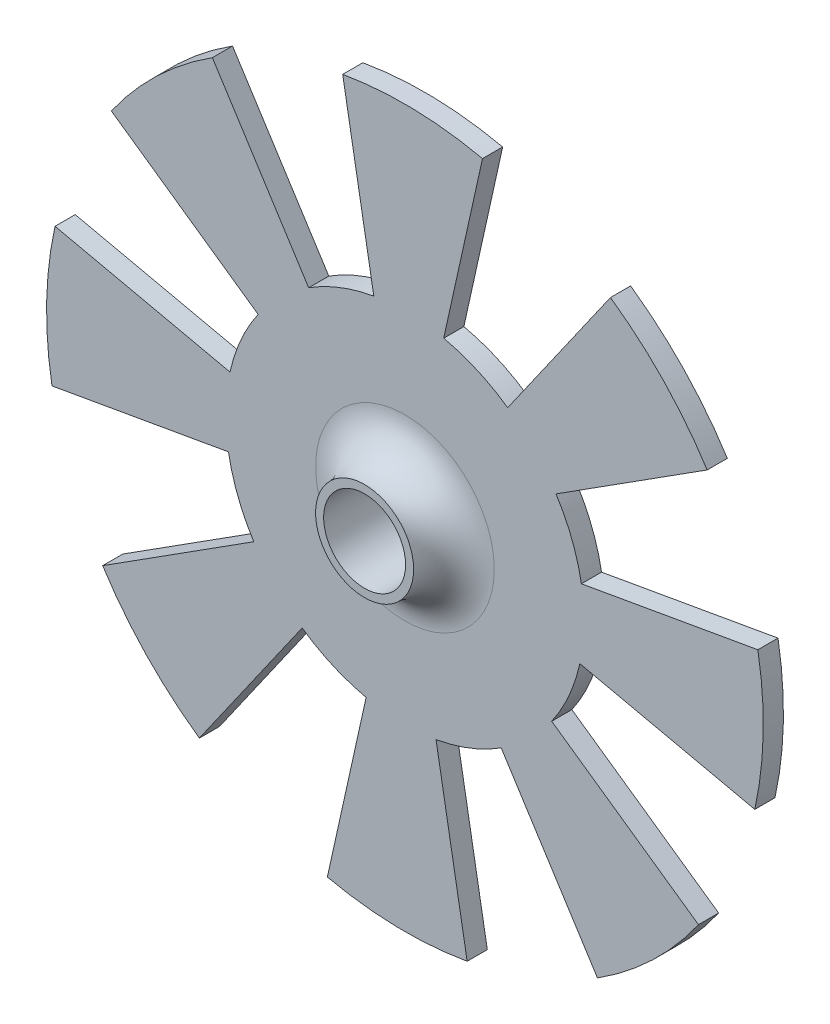
from build123d import *

# Parameters (mm, degrees)
SKETCH1_R           = 8.89
SKETCH1_R_2         = 1.016
BOSS_EXTRUDE1_DEPTH = 0.5
CUT_EXTRUDE1_DEPTH  = 0.5
BOSS_EXTRUDE2_START = 1
SKETCH3_R           = 1.216
SKETCH3_R_2         = 1.016
BOSS_EXTRUDE2_DEPTH = 1
FILLET1_R           = 1


with BuildPart() as part:
    # Sketch1 → Boss-Extrude1 (new body)
    with BuildSketch(Plane.XY):
        Circle(SKETCH1_R)
        Circle(SKETCH1_R_2, mode=Mode.SUBTRACT)
    extrude(amount=-BOSS_EXTRUDE1_DEPTH)

    # Sketch2 → Cut-Extrude1 (cut)
    with BuildSketch(Plane.XY):
        with BuildLine():
            ThreePointArc((-2.388296759, 3.748874977), (-1.61103708, 4.142774979), (-0.77186615, 4.377470462))
            Line((-0.77186615, 4.377470462), (-1.543732299, 8.754940924))
            ThreePointArc((-1.543732299, 8.754940924), (-3.22207416, 8.285549958), (-4.776593518, 7.497749953))
            Line((-4.776593518, 7.497749953), (-2.388296759, 3.748874977))
        make_face()
        with BuildLine():
            ThreePointArc((5.099094519, 7.282261674), (3.580418073, 8.137119049), (1.924148168, 8.679271503))
            Line((1.924148168, 8.679271503), (0.962074084, 4.339635752))
            ThreePointArc((0.962074084, 4.339635752), (1.790209036, 4.068559525), (2.54954726, 3.641130837))
            Line((2.54954726, 3.641130837), (5.099094519, 7.282261674))
        make_face()
        with BuildLine():
            ThreePointArc((8.754940924, 1.543732299), (8.285549958, 3.22207416), (7.497749953, 4.776593518))
            Line((7.497749953, 4.776593518), (3.748874977, 2.388296759))
            ThreePointArc((3.748874977, 2.388296759), (4.142774979, 1.61103708), (4.377470462, 0.77186615))
            Line((4.377470462, 0.77186615), (8.754940924, 1.543732299))
        make_face()
        with BuildLine():
            ThreePointArc((7.282261674, -5.099094519), (8.137119049, -3.580418073), (8.679271503, -1.924148168))
            Line((8.679271503, -1.924148168), (4.339635752, -0.962074084))
            ThreePointArc((4.339635752, -0.962074084), (4.068559525, -1.790209036), (3.641130837, -2.54954726))
            Line((3.641130837, -2.54954726), (7.282261674, -5.099094519))
        make_face()
        with BuildLine():
            ThreePointArc((1.543732299, -8.754940924), (3.22207416, -8.285549958), (4.776593518, -7.497749953))
            Line((4.776593518, -7.497749953), (2.388296759, -3.748874977))
            ThreePointArc((2.388296759, -3.748874977), (1.61103708, -4.142774979), (0.77186615, -4.377470462))
            Line((0.77186615, -4.377470462), (1.543732299, -8.754940924))
        make_face()
        with BuildLine():
            Line((-2.54954726, -3.641130837), (-5.099094519, -7.282261674))
            ThreePointArc((-5.099094519, -7.282261674), (-3.580418073, -8.137119049), (-1.924148168, -8.679271503))
            Line((-1.924148168, -8.679271503), (-0.962074084, -4.339635752))
            ThreePointArc((-0.962074084, -4.339635752), (-1.790209036, -4.068559525), (-2.54954726, -3.641130837))
        make_face()
        with BuildLine():
            Line((-4.377470462, -0.77186615), (-8.754940924, -1.543732299))
            ThreePointArc((-8.754940924, -1.543732299), (-8.285549958, -3.22207416), (-7.497749953, -4.776593518))
            Line((-7.497749953, -4.776593518), (-3.748874977, -2.388296759))
            ThreePointArc((-3.748874977, -2.388296759), (-4.142774979, -1.61103708), (-4.377470462, -0.77186615))
        make_face()
        with BuildLine():
            Line((-3.641130837, 2.54954726), (-7.282261674, 5.099094519))
            ThreePointArc((-7.282261674, 5.099094519), (-8.137119049, 3.580418073), (-8.679271503, 1.924148168))
            Line((-8.679271503, 1.924148168), (-4.339635752, 0.962074084))
            ThreePointArc((-4.339635752, 0.962074084), (-4.068559525, 1.790209036), (-3.641130837, 2.54954726))
        make_face()
    extrude(amount=-CUT_EXTRUDE1_DEPTH, mode=Mode.SUBTRACT)

    # Sketch3 → Boss-Extrude2 (add)
    with BuildSketch(Plane.XY.offset(BOSS_EXTRUDE2_START)):
        Circle(SKETCH3_R)
        Circle(SKETCH3_R_2, mode=Mode.SUBTRACT)
    extrude(amount=-BOSS_EXTRUDE2_DEPTH)

    # Fillet1
    fillet1_edges = [part.edges().sort_by_distance(p)[0] for p in [
        (-1.216, 0, 0),
    ]]
    fillet(fillet1_edges, radius=FILLET1_R - 0.0001)  # a hair under: the kernel refuses the full size


solid = part.part
